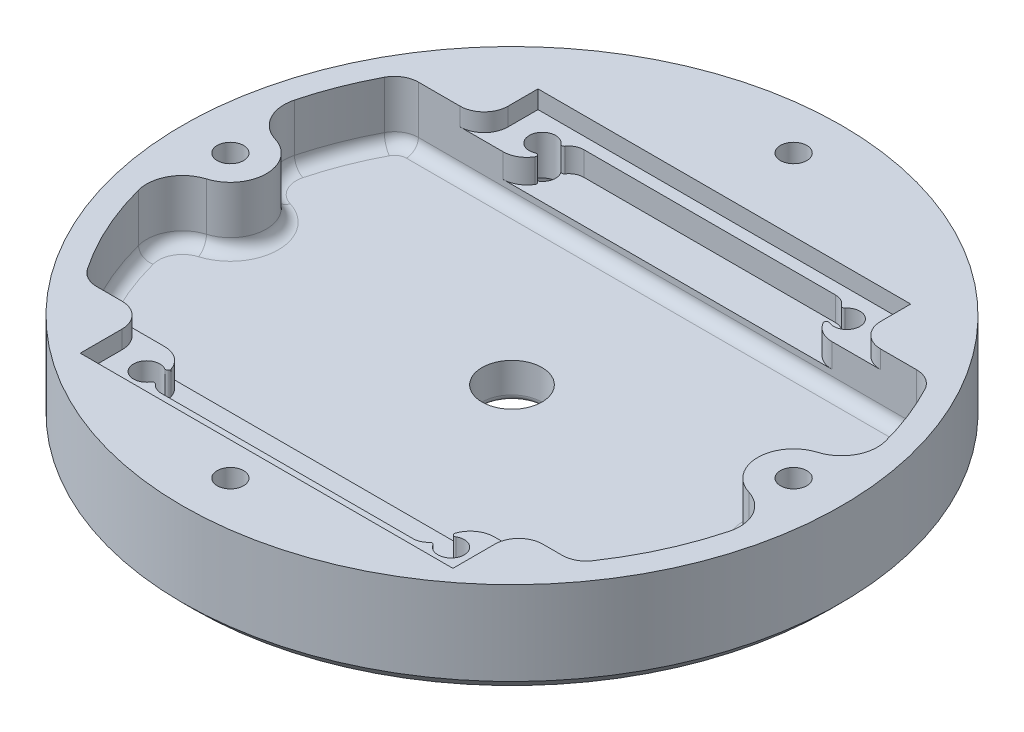
from build123d import *

# Parameters (mm, degrees)
SKETCH_1_R          = 27.5
EXTRUDE_1_DEPTH     = 3
EXTRUDE_START       = 5
SKETCH_2_R          = 27.5
SKETCH_2_R_2        = 25.500000000000004
EXTRUDE_2_DEPTH     = 5
EXTRUDE_3_DEPTH     = 5
CUT_EXTRUDE_1_DEPTH = 1.5
CUT_EXTRUDE_2_DEPTH = 2
SKETCH_8_R          = 1.100000000000001
CUT_EXTRUDE_3_DEPTH = 40.430318284284745
EXTRUDE_4_REACH     = 41.705
SKETCH_10_R         = 1.1
SKETCH_10_R_2       = 1.1000000000000827
SKETCH_10_R_3       = 1.0999999999999992
CUT_EXTRUDE_4_DEPTH = 40.70516339218364
CUT_EXTRUDE_5_DEPTH = 3.2
CUT_EXTRUDE_7_DEPTH = 3.2
FILLET_1_R          = 2
FILLET_2_R          = 3
CHAMFER_1_SIZE      = 1
SKETCH_13_R         = 2.5
CUT_EXTRUDE_6_DEPTH = 40.210968006413715
FILLET_3_R          = 0.5
FILLET_4_R          = 1
FILLET_5_R          = 0.2


with BuildPart() as part:
    # Эскиз1 → Бобышка-Вытянуть1 (new body)
    with BuildSketch(Plane(origin=(0, 0, 0), x_dir=(1, 0, 0), z_dir=(0, 1, 0))):
        with Locations(Location((0, 0, 0), (0, 0, 270))):
            Circle(SKETCH_1_R)
    extrude(amount=-EXTRUDE_1_DEPTH)

    # Эскиз2 → Бобышка-Вытянуть2 (add)
    with BuildSketch(Plane(origin=(0, 0, 0), x_dir=(1, 0, 0), z_dir=(0, 1, 0)).offset(EXTRUDE_START)):
        with Locations(Location((0, 0, 0), (0, 0, 270))):
            Circle(SKETCH_2_R)
        with Locations(Location((0, 0, 0), (0, 0, 270))):
            Circle(SKETCH_2_R_2, mode=Mode.SUBTRACT)
    extrude(amount=-EXTRUDE_2_DEPTH)

    # Эскиз3 → Бобышка-Вытянуть3 (add)
    with BuildSketch(Plane(origin=(0, 0, 0), x_dir=(1, 0, 0), z_dir=(0, 1, 0)).offset(EXTRUDE_START)):
        with BuildLine():
            ThreePointArc((21.95516112443724, 12.97), (-4.1e-15, 25.500000000000004), (-21.95516112443724, 12.969999999999997))
            Line((-21.955161124437236, 12.97), (21.955161124437236, 12.97))
        make_face()
        with BuildLine():
            Line((20.452312827648612, -15.23), (-20.452312827648612, -15.23))
            ThreePointArc((-20.45231282764862, -15.229999999999997), (-4.68e-15, -25.500000000000004), (20.452312827648615, -15.230000000000002))
        make_face()
    extrude(amount=-EXTRUDE_3_DEPTH)

    # Эскиз6 → Вырез-Вытянуть1 (cut)
    with BuildSketch(Plane(origin=(0, 5, 0), x_dir=(1, 0, 0), z_dir=(0, 1, 0))):
        Polygon((-15.300000000000002, 17.470000000000002), (15.799999999999992, 17.470000000000002), (15.8, -20.73), (-15.3, -20.73), align=None)
    extrude(amount=-CUT_EXTRUDE_1_DEPTH, mode=Mode.SUBTRACT)

    # Эскиз7 → Вырез-Вытянуть2 (cut)
    with BuildSketch(Plane(origin=(0, 3.5, 0), x_dir=(1, 0, 0), z_dir=(0, 1, 0))):
        with BuildLine():
            Line((10.5, 16.49000000000001), (-10.5, 16.49000000000001))
            ThreePointArc((-10.5, 16.49000000000001), (-11.383883476483188, 16.123883476483194), (-11.750000000000007, 15.240000000000004))
            Line((-11.75, 15.240000000000004), (-11.75, 12.970000000000004))
            Line((-11.75, 12.970000000000004), (11.75, 12.970000000000004))
            Line((11.75, 12.970000000000004), (11.75, 15.240000000000004))
            ThreePointArc((11.750000000000007, 15.240000000000004), (11.383883476483188, 16.123883476483194), (10.5, 16.49000000000001))
        make_face()
        with BuildLine():
            Line((11.75, -17.5), (11.75, -15.230000000000006))
            Line((11.75, -15.230000000000006), (-11.75, -15.230000000000006))
            Line((-11.75, -15.230000000000006), (-11.75, -17.5))
            ThreePointArc((-11.750000000000009, -17.5), (-11.383883476483192, -18.38388347648319), (-10.5, -18.750000000000007))
            Line((-10.5, -18.750000000000007), (10.5, -18.750000000000007))
            ThreePointArc((10.5, -18.750000000000007), (11.38388347648319, -18.38388347648319), (11.750000000000005, -17.5))
        make_face()
    extrude(amount=-CUT_EXTRUDE_2_DEPTH, mode=Mode.SUBTRACT)

    # Эскиз8 → Вырез-Вытянуть3 (cut, through all)
    with BuildSketch(Plane(origin=(0, 3.5, 0), x_dir=(1, 0, 0), z_dir=(0, 1, 0))):
        with Locations(Location((-12.699999999999998, -17.78, 0), (0, 0, 270))):
            Circle(SKETCH_8_R)
        with Locations(Location((12.699999999999994, -17.78, 0), (0, 0, 193.385963299))):
            Circle(SKETCH_8_R)
        with Locations(Location((-12.699999999999998, 15.24, 0), (0, 0, 270))):
            Circle(SKETCH_8_R)
        with Locations(Location((12.699999999999998, 15.24, 0), (0, 0, 210.272641319))):
            Circle(SKETCH_8_R)
    extrude(amount=-CUT_EXTRUDE_3_DEPTH, mode=Mode.SUBTRACT)

    # Эскиз9 → Бобышка-Вытянуть4 (add, up to next)
    with BuildSketch(Plane(origin=(0, 5, 0), x_dir=(1, 0, 0), z_dir=(0, 1, 0)), mode=Mode.PRIVATE) as extrude_4_sk1:
        with BuildLine():
            Line((-23.5, 3.0000000000000004), (-25.322914524201202, 3.000000000000001))
            ThreePointArc((-25.322914524201202, 3.000000000000001), (-25.500000000000004, -3.12e-15), (-25.322914524201202, -3.000000000000001))
            Line((-25.322914524201202, -3.000000000000001), (-23.5, -3.0000000000000004))
            ThreePointArc((-23.5, -3.0000000000000004), (-20.5, 0), (-23.5, 3.0000000000000004))
        make_face()
    extrude_4_tool1 = extrude(extrude_4_sk1.sketch, amount=-EXTRUDE_4_REACH, mode=Mode.PRIVATE) - part.part
    # Эскиз9 → Бобышка-Вытянуть4 (add, up to next)
    with BuildSketch(Plane(origin=(0, 5, 0), x_dir=(1, 0, 0), z_dir=(0, 1, 0)), mode=Mode.PRIVATE) as extrude_4_sk2:
        with BuildLine():
            Line((23.500000000000007, 3.000000000000006), (25.322914524201202, 3.000000000000001))
            ThreePointArc((25.322914524201202, 3.000000000000001), (25.500000000000004, 0), (25.322914524201202, -3.000000000000001))
            Line((25.322914524201202, -3.000000000000001), (23.500000000000007, -3.000000000000006))
            ThreePointArc((23.500000000000007, -3.000000000000006), (20.499999999999996, 5.39e-15), (23.500000000000007, 3.000000000000006))
        make_face()
    extrude_4_tool2 = extrude(extrude_4_sk2.sketch, amount=-EXTRUDE_4_REACH, mode=Mode.PRIVATE) - part.part
    add(extrude_4_tool1.solids().sort_by_distance((-23.240587, 5, 0))[0])
    add(extrude_4_tool2.solids().sort_by_distance((23.240587, 5, 0))[0])

    # Эскиз10 → Вырез-Вытянуть4 (cut, through all)
    with BuildSketch(Plane(origin=(0, 5, 0), x_dir=(1, 0, 0), z_dir=(0, 1, 0))):
        with Locations(Location((1.7e-16, 23.5, 0), (0, 0, 270))):
            Circle(SKETCH_10_R)
        with Locations(Location((23.5, 1.27e-15, 0), (0, 0, 270))):
            Circle(SKETCH_10_R_2)
        with Locations(Location((2.71e-15, -23.5, 0), (0, 0, 270))):
            Circle(SKETCH_10_R)
        with Locations(Location((-23.5, -4.15e-15, 0), (0, 0, 270))):
            Circle(SKETCH_10_R_3)
    extrude(amount=-CUT_EXTRUDE_4_DEPTH, mode=Mode.SUBTRACT)

    # Эскиз11 → Вырез-Вытянуть5 (cut)
    with BuildSketch(Plane.XZ.offset(3)):
        Polygon((13.825833024919767, 15.830000000000004), (14.951666049839536, 17.780000000000005), (13.825833024919769, 19.73), (11.574166975080226, 19.73), (10.448333950160457, 17.78), (11.574166975080223, 15.830000000000004), align=None)
        Polygon((-11.57416697508022, 15.830000000000004), (-13.825833024919763, 15.830000000000004), (-14.951666049839533, 17.780000000000005), (-13.825833024919765, 19.73), (-11.574166975080223, 19.73), (-10.448333950160452, 17.78), align=None)
        Polygon((11.574166975080223, -13.290000000000003), (13.825833024919767, -13.290000000000003), (14.951666049839536, -15.240000000000004), (13.825833024919769, -17.19), (11.574166975080226, -17.19), (10.448333950160457, -15.24), align=None)
        Polygon((-10.448333950160453, -15.24), (-11.57416697508022, -13.290000000000003), (-13.825833024919763, -13.290000000000003), (-14.951666049839533, -15.240000000000004), (-13.825833024919765, -17.19), (-11.574166975080223, -17.19), align=None)
    extrude(amount=-CUT_EXTRUDE_5_DEPTH, mode=Mode.SUBTRACT)

    # Эскиз15 → Вырез-Вытянуть7 (cut)
    with BuildSketch(Plane.XZ.offset(3)):
        Polygon((21.549999999999997, -1.1258330249197621), (23.500000000000004, -2.2516660498395358), (25.449999999999996, -1.1258330249197697), (25.449999999999996, 1.1258330249197728), (23.499999999999996, 2.251666049839544), (21.549999999999997, 1.1258330249197754), align=None)
        Polygon((1.1258330249197734, 21.549999999999994), (2.251666049839546, 23.499999999999996), (1.1258330249197726, 25.45), (-1.125833024919776, 25.45), (-2.251666049839546, 23.5), (-1.125833024919771, 21.549999999999994), align=None)
        Polygon((-1.1258330249197634, -21.549999999999994), (-2.2516660498395367, -23.5), (-1.1258330249197708, -25.449999999999992), (1.1258330249197717, -25.449999999999992), (2.2516660498395433, -23.499999999999993), (1.125833024919774, -21.549999999999994), align=None)
        Polygon((-21.549999999999997, 1.1258330249197666), (-23.500000000000004, 2.2516660498395398), (-25.449999999999996, 1.1258330249197734), (-25.449999999999996, -1.125833024919769), (-23.499999999999996, -2.25166604983954), (-21.549999999999997, -1.125833024919771), align=None)
    extrude(amount=-CUT_EXTRUDE_7_DEPTH, mode=Mode.SUBTRACT)

    # Скругление1
    # the kernel refuses this fillet: 2 mm, written as the material it adds along each edge
    with BuildSketch(Plane(origin=(20.452312827648615, 5, 15.230000000000004), x_dir=(0.580245292359204, 0, -0.8144417724398607), z_dir=(0, -1, 0))) as fillet_1_piece_1:
        with BuildLine():
            CenterArc((1.0310944294019202, -1.9995571539196326), FILLET_1_R, 88.79425061564854, 55.73795233840187)
            Line((-0.5977891154778013, -0.8390665692012247), (0, 0))
            ThreePointArc((0, 0), (0.536589958158139, 0.00564628752468579), (1.0731799163162792, -5e-17))
        make_face()
    extrude(amount=7.6829497907906985)
    with BuildSketch(Plane(origin=(-20.452312827648615, 5, 15.229999999999999), x_dir=(1, 0, 1.72e-15), z_dir=(0, -1, 0))) as fillet_1_piece_2:
        with BuildLine():
            CenterArc((1.0302351838948383, -2), FILLET_1_R, 89.9999999999999, 55.737952338402195)
            ThreePointArc((-0.6227075942969778, -0.8740425531914962), (-0.315952369567804, -0.43374504484024656), (0, 0))
            Line((0, 0), (1.0302351838948418, 0))
        make_face()
    extrude(amount=7.682949790790725)
    with BuildSketch(Plane(origin=(-21.95516112443724, 5, -12.969999999999999), x_dir=(1, 0, -1.51e-15), z_dir=(0, -1, 0))) as fillet_1_piece_3:
        with BuildLine():
            CenterArc((1.1727382627976408, 2), FILLET_1_R, 207.82732867752586, 62.17267132247423)
            ThreePointArc((-0.5959785764908342, 1.066382978723401), (-0.30437607771065067, 0.5296220497046682), (0, 0))
            Line((0, 0), (1.172738262797644, 0))
        make_face()
    extrude(amount=5)
    with BuildSketch(Plane(origin=(21.955161124437236, 5, -12.969999999999999), x_dir=(0.4878579588351138, 0, 0.8729230275352097), z_dir=(0, -1, 0))) as fillet_1_piece_4:
        with BuildLine():
            CenterArc((1.173716359934127, 1.9994261525379229), FILLET_1_R, 209.19988839763508, 62.17267132247423)
            Line((-0.5721296951362924, 1.0237102348676954), (0, 0))
            ThreePointArc((0, 0), (0.6108115750677633, -0.0073165551414893), (1.2216231501355264, -5e-17))
        make_face()
    extrude(amount=5)
    # the kernel refuses this fillet: 2 mm, written as the material it takes off along each edge
    with BuildSketch(Plane(origin=(15.799999999999994, 10, -12.97), x_dir=(1, 0, 0), z_dir=(0, -1, 0))) as fillet_1_2_piece_1:
        with BuildLine():
            CenterArc((FILLET_1_R, -FILLET_1_R), FILLET_1_R, 90, 90)
            Line((0, -FILLET_1_R), (0, 0))
            Line((0, 0), (FILLET_1_R, 0))
        make_face()
    extrude(amount=6.5, mode=Mode.SUBTRACT)
    with BuildSketch(Plane(origin=(-15.300000000000002, 3.5, -12.970000000000002), x_dir=(-1, 0, 8.9e-16), z_dir=(0, 1, 0))) as fillet_1_2_piece_2:
        with BuildLine():
            CenterArc((FILLET_1_R, -FILLET_1_R), FILLET_1_R, 89.99999999999994, 90.00000000000006)
            Line((-3.55e-15, -FILLET_1_R), (0, 0))
            Line((0, 0), (FILLET_1_R, 0))
        make_face()
    extrude(amount=6.5, mode=Mode.SUBTRACT)
    with BuildSketch(Plane(origin=(-11.75, 8.449144172021773, -12.970000000000004), x_dir=(-1, 0, 1.79e-15), z_dir=(0, -1, 0))) as fillet_1_2_piece_3:
        with BuildLine():
            CenterArc((1.9796576688087058, 2), FILLET_1_R, 188.17884142312394, 81.82115857687614)
            Line((1.824e-14, 1.7154731746795218), (0, 0))
            Line((0, 0), (1.9796576688087093, 0))
        make_face()
    extrude(amount=6.949144172021773, mode=Mode.SUBTRACT)
    with BuildSketch(Plane(origin=(11.75, 8.449144172023425, -12.970000000000004), x_dir=(1, 0, 1.79e-15), z_dir=(0, -1, 0))) as fillet_1_2_piece_4:
        with BuildLine():
            CenterArc((1.9796576688093666, -2), FILLET_1_R, 89.9999999999999, 81.82115857683293)
            Line((8.9221e-13, -1.7154731746780278), (0, 0))
            Line((0, 0), (1.97965766880937, 0))
        make_face()
    extrude(amount=6.949144172023425, mode=Mode.SUBTRACT)
    with BuildSketch(Plane(origin=(-15.300000000000002, 10, 15.23), x_dir=(-1, 0, 0), z_dir=(0, -1, 0))) as fillet_1_2_piece_5:
        with BuildLine():
            CenterArc((FILLET_1_R, -FILLET_1_R), FILLET_1_R, 90, 90)
            Line((-5.33e-15, -FILLET_1_R), (0, 0))
            Line((0, 0), (FILLET_1_R, 0))
        make_face()
    extrude(amount=6.5, mode=Mode.SUBTRACT)
    with BuildSketch(Plane(origin=(15.799999999999999, 3.5, 15.23), x_dir=(1, 0, 0), z_dir=(0, 1, 0))) as fillet_1_2_piece_6:
        with BuildLine():
            CenterArc((FILLET_1_R, -FILLET_1_R), FILLET_1_R, 90, 90)
            Line((1.78e-15, -FILLET_1_R), (0, 0))
            Line((0, 0), (FILLET_1_R, 0))
        make_face()
    extrude(amount=6.5000000000000036, mode=Mode.SUBTRACT)
    with BuildSketch(Plane(origin=(11.75, 8.5, 15.230000000000006), x_dir=(1, 0, -2.66e-15), z_dir=(0, -1, 0))) as fillet_1_2_piece_7:
        with BuildLine():
            CenterArc((FILLET_1_R, FILLET_1_R), FILLET_1_R, 180.00000000000006, 90.00000000000011)
            Line((-5.33e-15, FILLET_1_R), (0, 0))
            Line((0, 0), (FILLET_1_R, 0))
        make_face()
    extrude(amount=7, mode=Mode.SUBTRACT)
    with BuildSketch(Plane(origin=(-11.75, 8.5, 15.230000000000006), x_dir=(-1, 0, -2.66e-15), z_dir=(0, -1, 0))) as fillet_1_2_piece_8:
        with BuildLine():
            CenterArc((FILLET_1_R, -FILLET_1_R), FILLET_1_R, 89.99999999999984, 90.0000000000001)
            Line((-5.33e-15, -FILLET_1_R), (0, 0))
            Line((0, 0), (FILLET_1_R, 0))
        make_face()
    extrude(amount=7, mode=Mode.SUBTRACT)

    # Скругление2
    fillet_2_edges = [part.edges().sort_by_distance(p)[0] for p in [
        (-25.322914524201202, 2.5, -3.000000000000001),
        (-25.3229145242012, 2.5, 3.000000000000001),
        (25.322914524201202, 2.5, 3.000000000000001),
        (25.322914524201202, 2.5, -3.000000000000001),
    ]]
    fillet(fillet_2_edges, radius=FILLET_2_R)

    # Фаска1
    chamfer_1_edges = [part.edges().sort_by_distance(p)[0] for p in [
        (8.42e-15, -3, -27.5),
    ]]
    chamfer(chamfer_1_edges, length=CHAMFER_1_SIZE)

    # Эскиз13 → Вырез-Вытянуть6 (cut, through all)
    with BuildSketch(Plane(origin=(0, 0, 0), x_dir=(1, 0, 0), z_dir=(0, 1, 0))):
        with Locations(Location((0, 0, 0), (0, 0, 270))):
            Circle(SKETCH_13_R)
    extrude(amount=-CUT_EXTRUDE_6_DEPTH, mode=Mode.SUBTRACT)

    # Скругление3
    fillet_3_edges = [part.edges().sort_by_distance(p)[0] for p in [
        (7.7e-16, -3, -2.5),
    ]]
    fillet(fillet_3_edges, radius=FILLET_3_R)

    # Скругление4
    fillet_4_edges = [part.edges().sort_by_distance(p)[0] for p in [
        (2.487e-14, 0, 15.23),
        (23.757362739793972, 0, -9.264864578063138),
        (1.1724e-13, 0, -12.97),
        (-23.19993516122594, 0, 10.58361982097394),
        (21.81508107166005, 0, -12.682780494189743),
        (-21.81508107165982, 0, -12.682780494189668),
        (-20.35698007352488, 0, 14.998037739079262),
        (20.356980073524703, 0, 14.998037739079017),
        (-20.5, 0, -1.15e-15),
        (-23.757362739793898, 0, -9.264864578063337),
        (23.199935161225962, 0, 10.583619820973892),
        (20.499999999999993, 0, 8.9e-16),
        (24.375193048292562, 0, -4.279144112388528),
        (24.375193048292516, 0, 4.2791441123884395),
        (-24.37519304829257, 0, 4.279144112388517),
        (-24.375193048292516, 0, -4.279144112388437),
    ]]
    fillet(fillet_4_edges, radius=FILLET_4_R)

    # Скругление5
    # the kernel refuses this fillet: 0.2 mm, written as the material it takes off along each edge
    with BuildSketch(Plane(origin=(11.750000000000872, 5.466944980107487, -14.685473174678028), x_dir=(0.3341781577987448, 0, 0.9425099250672309), z_dir=(0, -1, 0))) as fillet_5_piece_1:
        with BuildLine():
            CenterArc((0.7474390924407581, -0.19609296514175445), FILLET_5_R, 78.65627152209768, 144.22358161946906)
            ThreePointArc((0.6008826495001093, -0.33218561385058204), (0.3270228393587025, -0.11801013789990962), (0, 0))
            ThreePointArc((0, 0), (0.39338899602151406, 0.0390703485824594), (0.7867779920429949, -1e-17))
        make_face()
    extrude(amount=3.9669449801074874, mode=Mode.SUBTRACT)
    with BuildSketch(Plane(origin=(11.68011363636364, 1.5, -15.652106546015236), x_dir=(-0.45271169644222253, 0, -0.8916569519183962), z_dir=(0, 1, 0))) as fillet_5_piece_2:
        with BuildLine():
            CenterArc((0.3602741319948139, -0.19821151703661213), FILLET_5_R, 97.66812537165218, 106.13201482487136)
            ThreePointArc((0.17728239591166237, -0.27892102406815206), (0.0991761553515327, -0.13276448582315614), (0, 0))
            ThreePointArc((0, 0), (0.1667935796272266, -0.01117801852116846), (0.3335871592544547, 1e-17))
        make_face()
    extrude(amount=2.8339678981361365, mode=Mode.SUBTRACT)
    with BuildSketch(Plane(origin=(11.750005143005279, 1.5, 17.225464363919155), x_dir=(0.1620860931245276, 0, -0.9867766203227692), z_dir=(0, 1, 0))) as fillet_5_piece_3:
        with BuildLine():
            CenterArc((0.6074218166934577, -0.19742833291803438), FILLET_5_R, 80.8019351983283, 138.86878401818814)
            ThreePointArc((0.4534766378234293, -0.32510324001678836), (0.24769440067059162, -0.1333206178889524), (0, 0))
            ThreePointArc((0, 0), (0.31969569299655815, 0.0257166708196497), (0.6393913859931133, 1e-17))
        make_face()
    extrude(amount=3.598478464982783, mode=Mode.SUBTRACT)
    with BuildSketch(Plane(origin=(-11.750005143005277, 1.5, 17.22546436391916), x_dir=(-0.1620860931245276, 0, -0.9867766203227692), z_dir=(0, 1, 0))) as fillet_5_piece_4:
        with BuildLine():
            CenterArc((0.6074218166934577, 0.19742833291803438), FILLET_5_R, 140.32928078348306, 138.86878401818865)
            ThreePointArc((0.4534766378234328, 0.32510324001678775), (0.2476944006705919, 0.13332061788895416), (0, 0))
            ThreePointArc((0, 0), (0.3196956929965549, -0.02571667081964737), (0.6393913859931133, -1e-17))
        make_face()
    extrude(amount=3.598478464982783, mode=Mode.SUBTRACT)
    with BuildSketch(Plane(origin=(-11.75, 1.5, -14.685473174679522), x_dir=(-0.33417815779913224, 0, 0.9425099250670935), z_dir=(0, 1, 0))) as fillet_5_piece_5:
        with BuildLine():
            CenterArc((0.7474390924425365, -0.19609296514177063), FILLET_5_R, 78.65627152212122, 144.2235816194691)
            ThreePointArc((0.6008826495019437, -0.3321856138506585), (0.3270228393596914, -0.11801013789967928), (0, 0))
            ThreePointArc((0, 0), (0.3933889960223306, 0.03907034858229812), (0.7867779920446928, -1e-17))
        make_face()
    extrude(amount=3.966944980111732, mode=Mode.SUBTRACT)
    with BuildSketch(Plane(origin=(-11.68011363636364, 1.5, -15.652106546015236), x_dir=(-0.5096742636393219, 0, -0.860367447654614), z_dir=(0, 1, 0))) as fillet_5_piece_6:
        with BuildLine():
            CenterArc((0.3605384164914607, -0.19773038690196756), FILLET_5_R, 98.6399276210163, 106.1320148248721)
            ThreePointArc((0.17894186169522608, -0.2815318862091876), (0.09890465319285795, -0.13476986265379978), (0, 0))
            ThreePointArc((0, 0), (0.1652467742252531, -0.01248287203918227), (0.33049354845050793, 1e-17))
        make_face()
    extrude(amount=2.8339678981361347, mode=Mode.SUBTRACT)
    with BuildSketch(Plane(origin=(-11.629884113424403, 1.5, 18.034660537379725), x_dir=(0.5489719610683469, 0, 0.8358407659122481), z_dir=(0, 1, 0))) as fillet_5_piece_7:
        with BuildLine():
            CenterArc((0.3745086288336861, -0.19806669543486916), FILLET_5_R, 97.97302701118393, 107.37636982336994)
            ThreePointArc((0.1937658743308281, -0.2836941250046018), (0.10802669358540175, -0.134235767393482), (0, 0))
            ThreePointArc((0, 0), (0.17338362446004216, -0.01208315353207255), (0.3467672489200804, 1e-17))
        make_face()
    extrude(amount=2.8669181223002003, mode=Mode.SUBTRACT)
    with BuildSketch(Plane(origin=(11.629884113425351, 4.366918122293131, 18.034660537383733), x_dir=(0.38058665832593364, 0, 0.9247452597901215), z_dir=(0, -1, 0))) as fillet_5_piece_8:
        with BuildLine():
            CenterArc((0.37478335525468787, 0.19754636299388337), FILLET_5_R, 153.63956712092354, 107.37636982336966)
            ThreePointArc((0.19557963500348263, 0.2863496661313651), (0.10776771186771862, 0.1363598331929876), (0, 0))
            ThreePointArc((0, 0), (0.17177570449173585, 0.01349500353363598), (0.3435514089834614, -1e-17))
        make_face()
    extrude(amount=2.8669181222931313, mode=Mode.SUBTRACT)


solid = part.part
